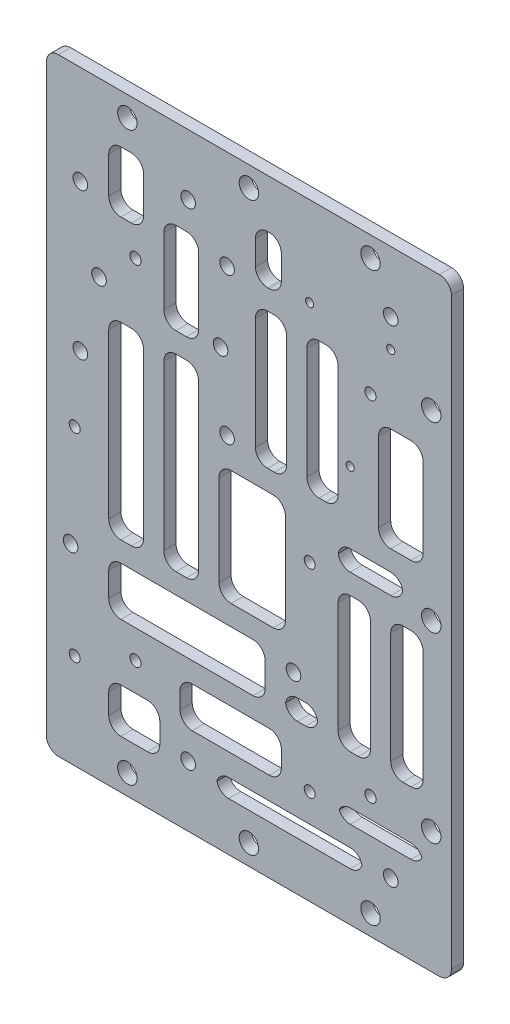
from build123d import *

# Parameters (mm, degrees)
ESQUISSE1_W             = 100
ESQUISSE1_H             = 150
BOSS_EXTRU_1_DEPTH      = 3
ESQUISSE2_R             = 1.375
ENL_V_MAT_EXTRU_1_DEPTH = 3
ESQUISSE3_R             = 2.4
ESQUISSE3_R_2           = 1.8
ENL_V_MAT_EXTRU_2_DEPTH = 3
ESQUISSE4_R             = 1.8
ESQUISSE4_R_2           = 1
ENL_V_MAT_EXTRU_3_DEPTH = 10
ESQUISSE5_R             = 1.35
ENL_V_MAT_EXTRU_4_DEPTH = 10
ESQUISSE6_W             = 8.6
ESQUISSE6_H             = 46.5
ESQUISSE6_W_2           = 38.6
ESQUISSE6_H_2           = 12
ESQUISSE6_W_3           = 25
ESQUISSE6_H_3           = 10
ESQUISSE6_W_4           = 16.4
ESQUISSE6_H_4           = 28.4
ESQUISSE6_W_5           = 8
ESQUISSE6_H_5           = 33.4
ESQUISSE6_W_6           = 7.7
ESQUISSE6_H_6           = 33.6
ESQUISSE6_W_7           = 11
ESQUISSE6_H_7           = 25.6
ESQUISSE6_W_8           = 16
ESQUISSE6_H_8           = 5
ESQUISSE6_W_9           = 36
ESQUISSE6_H_9           = 4.5
ESQUISSE6_W_10          = 21
ESQUISSE6_H_10          = 3.5
ESQUISSE6_H_11          = 22.5
ESQUISSE6_W_11          = 6.4
ESQUISSE6_H_12          = 15
ESQUISSE6_W_12          = 12.6
ESQUISSE6_H_13          = 11
ENL_V_MAT_EXTRU_5_DEPTH = 10
CONG_1_R                = 3


with BuildPart() as part:
    # Esquisse1 → Boss.-Extru.1 (new body)
    with BuildSketch(Plane.XY):
        with Locations((50, 75)):
            Rectangle(ESQUISSE1_W, ESQUISSE1_H)
    extrude(amount=BOSS_EXTRU_1_DEPTH)

    # Esquisse2 → Enlèv. mat.-Extru.1 (cut)
    with BuildSketch(Plane.XY.offset(3)):
        with Locations((22, 116)):
            Circle(ESQUISSE2_R)
        with Locations((80, 116)):
            Circle(ESQUISSE2_R)
        with Locations((80, 30)):
            Circle(ESQUISSE2_R)
        with Locations((22, 30)):
            Circle(ESQUISSE2_R)
    extrude(amount=-ENL_V_MAT_EXTRU_1_DEPTH, mode=Mode.SUBTRACT)

    # Esquisse3 → Enlèv. mat.-Extru.2 (cut)
    with BuildSketch(Plane.XY.offset(3)):
        with Locations((20, 145)):
            Circle(ESQUISSE3_R)
        with Locations((50, 145)):
            Circle(ESQUISSE3_R)
        with Locations((80, 145)):
            Circle(ESQUISSE3_R)
        with Locations((95, 120)):
            Circle(ESQUISSE3_R)
        with Locations((95, 75)):
            Circle(ESQUISSE3_R)
        with Locations((95, 30)):
            Circle(ESQUISSE3_R)
        with Locations((80, 5)):
            Circle(ESQUISSE3_R)
        with Locations((50, 5)):
            Circle(ESQUISSE3_R)
        with Locations((20, 5)):
            Circle(ESQUISSE3_R)
        with Locations((85, 135)):
            Circle(ESQUISSE3_R_2)
        with Locations((35, 135)):
            Circle(ESQUISSE3_R_2)
        with Locations((35, 15)):
            Circle(ESQUISSE3_R_2)
        with Locations((85, 15)):
            Circle(ESQUISSE3_R_2)
    extrude(amount=-ENL_V_MAT_EXTRU_2_DEPTH, mode=Mode.SUBTRACT)

    # Esquisse4 → Enlèv. mat.-Extru.3 (cut)
    with BuildSketch(Plane.XY.offset(3)):
        with Locations((13, 107.5)):
            Circle(ESQUISSE4_R)
        with Locations((44.6, 89.4)):
            Circle(ESQUISSE4_R)
        with Locations((6, 47)):
            Circle(ESQUISSE4_R)
        with Locations((61, 47)):
            Circle(ESQUISSE4_R)
        with Locations((8.4, 125.6)):
            Circle(ESQUISSE4_R)
        with Locations((44.6, 125.6)):
            Circle(ESQUISSE4_R)
        with Locations((85, 128)):
            Circle(ESQUISSE4_R_2)
        with Locations((65, 128)):
            Circle(ESQUISSE4_R_2)
        with Locations((75, 98)):
            Circle(ESQUISSE4_R_2)
        with Locations((8.4, 89.4)):
            Circle(ESQUISSE4_R)
        with Locations((43, 107.5)):
            Circle(ESQUISSE4_R)
    extrude(amount=-ENL_V_MAT_EXTRU_3_DEPTH, mode=Mode.SUBTRACT)

    # Esquisse5 → Enlèv. mat.-Extru.4 (cut)
    with BuildSketch(Plane.XY.offset(3)):
        with Locations((7, 72.5)):
            Circle(ESQUISSE5_R)
        with Locations((65, 72.5)):
            Circle(ESQUISSE5_R)
        with Locations((7, 23.5)):
            Circle(ESQUISSE5_R)
        with Locations((65, 23.5)):
            Circle(ESQUISSE5_R)
    extrude(amount=-ENL_V_MAT_EXTRU_4_DEPTH, mode=Mode.SUBTRACT)

    # Esquisse6 → Enlèv. mat.-Extru.5 (cut)
    with BuildSketch(Plane.XY.offset(3)):
        with Locations((19.7, 77.25)):
            Rectangle(ESQUISSE6_W, ESQUISSE6_H)
        with Locations((33.3, 77.25)):
            Rectangle(ESQUISSE6_W, ESQUISSE6_H)
        with Locations((34.7, 43)):
            Rectangle(ESQUISSE6_W_2, ESQUISSE6_H_2)
        with Locations((45.5, 27)):
            Rectangle(ESQUISSE6_W_3, ESQUISSE6_H_3)
        with Locations((50.8, 68.2)):
            Rectangle(ESQUISSE6_W_4, ESQUISSE6_H_4)
        with Locations((76, 53.7)):
            Rectangle(ESQUISSE6_W_5, ESQUISSE6_H_5)
        with Locations((89, 53.7)):
            Rectangle(ESQUISSE6_W_5, ESQUISSE6_H_5)
        with Locations((55.45, 104.2)):
            Rectangle(ESQUISSE6_W_6, ESQUISSE6_H_6)
        with Locations((68.15, 104.2)):
            Rectangle(ESQUISSE6_W_6, ESQUISSE6_H_6)
        with Locations((87.5, 98.2)):
            Rectangle(ESQUISSE6_W_7, ESQUISSE6_H_7)
        with Locations((80, 77.9)):
            Rectangle(ESQUISSE6_W_8, ESQUISSE6_H_8)
        with Locations((60, 14.25)):
            Rectangle(ESQUISSE6_W_9, ESQUISSE6_H_9)
        with Locations((63, 39.5)):
            Rectangle(ESQUISSE6_W_5, ESQUISSE6_H_8)
        with Locations((82.5, 23.25)):
            Rectangle(ESQUISSE6_W_10, ESQUISSE6_H_10)
        with Locations((33.3, 116.75)):
            Rectangle(ESQUISSE6_W, ESQUISSE6_H_11)
        with Locations((54.8, 132)):
            Rectangle(ESQUISSE6_W_11, ESQUISSE6_H_2)
        with Locations((19.7, 130.5)):
            Rectangle(ESQUISSE6_W, ESQUISSE6_H_12)
        with Locations((21.7, 17.5)):
            Rectangle(ESQUISSE6_W_12, ESQUISSE6_H_13)
    extrude(amount=-ENL_V_MAT_EXTRU_5_DEPTH, mode=Mode.SUBTRACT)

    # Congé1
    # the kernel refuses this fillet: 3 mm, written as the material it adds along each edge
    with BuildSketch(Plane(origin=(28, 23, 3), x_dir=(-1, 0, 0), z_dir=(0, 0, -1)), Plane(origin=(93, 25, 3), x_dir=(-1, 0, 0), z_dir=(0, 0, -1)), Plane(origin=(78, 16.5, 3), x_dir=(-1, 0, 0), z_dir=(0, 0, -1)), Plane(origin=(58, 32, 3), x_dir=(-1, 0, 0), z_dir=(0, 0, -1)), Plane(origin=(67, 42, 3), x_dir=(-1, 0, 0), z_dir=(0, 0, -1)), Plane(origin=(59.3, 121, 3), x_dir=(-1, 0, 0), z_dir=(0, 0, -1)), Plane(origin=(37.6, 128, 3), x_dir=(-1, 0, 0), z_dir=(0, 0, -1)), Plane(origin=(54, 49, 3), x_dir=(-1, 0, 0), z_dir=(0, 0, -1)), Plane(origin=(93, 70.4, 3), x_dir=(-1, 0, 0), z_dir=(0, 0, -1)), Plane(origin=(80, 70.4, 3), x_dir=(-1, 0, 0), z_dir=(0, 0, -1)), Plane(origin=(72, 121, 3), x_dir=(-1, 0, 0), z_dir=(0, 0, -1)), Plane(origin=(58, 138, 3), x_dir=(-1, 0, 0), z_dir=(0, 0, -1)), Plane(origin=(15.4, 123, 3), x_dir=(1, 0, 0), z_dir=(0, 0, -1)), Plane(origin=(15.4, 54, 3), x_dir=(1, 0, 0), z_dir=(0, 0, -1)), Plane(origin=(29, 54, 3), x_dir=(1, 0, 0), z_dir=(0, 0, -1)), Plane(origin=(42.6, 54, 3), x_dir=(1, 0, 0), z_dir=(0, 0, -1)), Plane(origin=(42, 16.5, 3), x_dir=(0, -1, 0), z_dir=(0, 0, -1)), Plane(origin=(15.4, 23, 3), x_dir=(0, -1, 0), z_dir=(0, 0, -1)), Plane(origin=(33, 32, 3), x_dir=(0, -1, 0), z_dir=(0, 0, -1)), Plane(origin=(15.4, 49, 3), x_dir=(0, -1, 0), z_dir=(0, 0, -1)), Plane(origin=(59, 42, 3), x_dir=(0, -1, 0), z_dir=(0, 0, -1)), Plane(origin=(72, 25, 3), x_dir=(0, -1, 0), z_dir=(0, 0, -1)), Plane(origin=(85, 70.4, 3), x_dir=(0, -1, 0), z_dir=(0, 0, -1)), Plane(origin=(72, 80.4, 3), x_dir=(0, -1, 0), z_dir=(0, 0, -1)), Plane(origin=(72, 70.4, 3), x_dir=(0, -1, 0), z_dir=(0, 0, -1)), Plane(origin=(29, 100.5, 3), x_dir=(0, -1, 0), z_dir=(0, 0, -1)), Plane(origin=(42.6, 82.4, 3), x_dir=(0, -1, 0), z_dir=(0, 0, -1)), Plane(origin=(15.4, 100.5, 3), x_dir=(0, -1, 0), z_dir=(0, 0, -1)), Plane(origin=(29, 128, 3), x_dir=(0, -1, 0), z_dir=(0, 0, -1)), Plane(origin=(82, 111, 3), x_dir=(0, -1, 0), z_dir=(0, 0, -1)), Plane(origin=(64.3, 121, 3), x_dir=(0, -1, 0), z_dir=(0, 0, -1)), Plane(origin=(51.6, 121, 3), x_dir=(0, -1, 0), z_dir=(0, 0, -1)), Plane(origin=(51.6, 138, 3), x_dir=(0, -1, 0), z_dir=(0, 0, -1)), Plane(origin=(15.4, 138, 3), x_dir=(0, -1, 0), z_dir=(0, 0, -1)), Plane(origin=(28, 12, 3), x_dir=(0, 1, 0), z_dir=(0, 0, -1)), Plane(origin=(58, 126, 3), x_dir=(0, 1, 0), z_dir=(0, 0, -1)), Plane(origin=(24, 123, 3), x_dir=(0, 1, 0), z_dir=(0, 0, -1)), Plane(origin=(59.3, 87.4, 3), x_dir=(0, 1, 0), z_dir=(0, 0, -1)), Plane(origin=(37.6, 105.5, 3), x_dir=(0, 1, 0), z_dir=(0, 0, -1)), Plane(origin=(24, 54, 3), x_dir=(0, 1, 0), z_dir=(0, 0, -1)), Plane(origin=(37.6, 54, 3), x_dir=(0, 1, 0), z_dir=(0, 0, -1)), Plane(origin=(54, 37, 3), x_dir=(0, 1, 0), z_dir=(0, 0, -1)), Plane(origin=(58, 22, 3), x_dir=(0, 1, 0), z_dir=(0, 0, -1)), Plane(origin=(59, 54, 3), x_dir=(0, 1, 0), z_dir=(0, 0, -1)), Plane(origin=(67, 37, 3), x_dir=(0, 1, 0), z_dir=(0, 0, -1)), Plane(origin=(78, 12, 3), x_dir=(0, 1, 0), z_dir=(0, 0, -1)), Plane(origin=(93, 21.5, 3), x_dir=(0, 1, 0), z_dir=(0, 0, -1)), Plane(origin=(80, 37, 3), x_dir=(0, 1, 0), z_dir=(0, 0, -1)), Plane(origin=(93, 37, 3), x_dir=(0, 1, 0), z_dir=(0, 0, -1)), Plane(origin=(93, 85.4, 3), x_dir=(0, 1, 0), z_dir=(0, 0, -1)), Plane(origin=(72, 87.4, 3), x_dir=(0, 1, 0), z_dir=(0, 0, -1)), Plane(origin=(88, 75.4, 3), x_dir=(0, 1, 0), z_dir=(0, 0, -1)), Plane(origin=(88, 80.4, 3), x_dir=(-1, 0, 0), z_dir=(0, 0, -1)), Plane(origin=(93, 111, 3), x_dir=(-1, 0, 0), z_dir=(0, 0, -1))) as cong_1_piece_1:
        with BuildLine():
            CenterArc((CONG_1_R, -CONG_1_R), CONG_1_R, 90, 90)
            Line((0, -CONG_1_R), (0, 0))
            Line((0, 0), (CONG_1_R, 0))
        make_face()
    extrude(amount=3)
    with BuildSketch(Plane(origin=(24, 138, 3), x_dir=(0, -1, 0), z_dir=(0, 0, -1)), Plane(origin=(24, 100.5, 3), x_dir=(0, -1, 0), z_dir=(0, 0, -1)), Plane(origin=(37.6, 100.5, 3), x_dir=(0, -1, 0), z_dir=(0, 0, -1)), Plane(origin=(59, 82.4, 3), x_dir=(0, -1, 0), z_dir=(0, 0, -1)), Plane(origin=(72, 75.4, 3), x_dir=(0, 1, 0), z_dir=(0, 0, -1)), Plane(origin=(82, 85.4, 3), x_dir=(0, 1, 0), z_dir=(0, 0, -1)), Plane(origin=(64.3, 87.4, 3), x_dir=(0, 1, 0), z_dir=(0, 0, -1)), Plane(origin=(51.6, 126, 3), x_dir=(0, 1, 0), z_dir=(0, 0, -1)), Plane(origin=(51.6, 87.4, 3), x_dir=(0, 1, 0), z_dir=(0, 0, -1)), Plane(origin=(29, 105.5, 3), x_dir=(0, 1, 0), z_dir=(0, 0, -1)), Plane(origin=(85, 37, 3), x_dir=(0, 1, 0), z_dir=(0, 0, -1)), Plane(origin=(59, 37, 3), x_dir=(0, 1, 0), z_dir=(0, 0, -1)), Plane(origin=(72, 37, 3), x_dir=(0, 1, 0), z_dir=(0, 0, -1)), Plane(origin=(72, 21.5, 3), x_dir=(0, 1, 0), z_dir=(0, 0, -1)), Plane(origin=(33, 22, 3), x_dir=(0, 1, 0), z_dir=(0, 0, -1)), Plane(origin=(15.4, 37, 3), x_dir=(0, 1, 0), z_dir=(0, 0, -1)), Plane(origin=(42, 12, 3), x_dir=(0, 1, 0), z_dir=(0, 0, -1)), Plane(origin=(15.4, 12, 3), x_dir=(0, 1, 0), z_dir=(0, 0, -1))) as cong_1_piece_2:
        with BuildLine():
            CenterArc((CONG_1_R, CONG_1_R), CONG_1_R, 180, 90)
            Line((0, CONG_1_R), (0, 0))
            Line((0, 0), (CONG_1_R, 0))
        make_face()
    extrude(amount=3)
    # the kernel refuses this fillet: 3 mm, written as the material it takes off along each edge
    with BuildSketch(Plane(origin=(0, 150, -7.5), x_dir=(0, -1, 0), z_dir=(0, 0, 1)), Plane(origin=(100, 150, -7.5), x_dir=(-1, 0, 0), z_dir=(0, 0, 1))) as cong_1_2_piece_1:
        with BuildLine():
            CenterArc((CONG_1_R, CONG_1_R), CONG_1_R, 180, 90)
            Line((0, CONG_1_R), (0, 0))
            Line((0, 0), (CONG_1_R, 0))
        make_face()
    extrude(amount=18, mode=Mode.SUBTRACT)
    with BuildSketch(Plane(origin=(100, 0, -7.5), x_dir=(-1, 0, 0), z_dir=(0, 0, 1)), Plane(origin=(0, 0, -7.5), x_dir=(0, 1, 0), z_dir=(0, 0, 1))) as cong_1_2_piece_2:
        with BuildLine():
            CenterArc((CONG_1_R, -CONG_1_R), CONG_1_R, 90, 90)
            Line((0, -CONG_1_R), (0, 0))
            Line((0, 0), (CONG_1_R, 0))
        make_face()
    extrude(amount=18, mode=Mode.SUBTRACT)


solid = part.part
